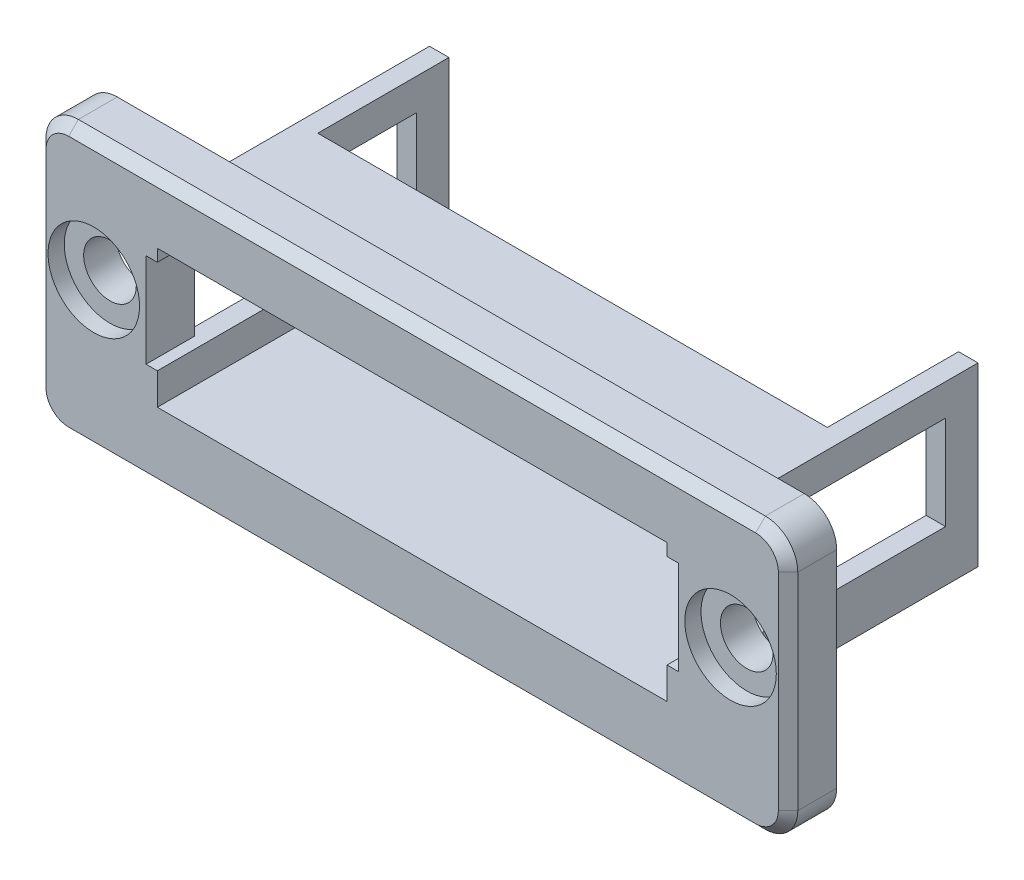
from build123d import *

# Parameters (mm, degrees)
FLANGE_DEPTH             = 3
FRONT_BEVEL_SIZE         = 0.6
OPENING_HOLES_DEPTH      = 26.160177364
OPENING_HOLES_DEPTH_BACK = 26.160177364
SK_OPENING_R             = 1.625
SK_COUNTERBORE_R         = 2.825
COUNTERBORE_DEPTH        = 1
SK_LONG_WALLS_W          = 33.86
SK_LONG_WALLS_H          = 1.2
LONG_WALLS_DEPTH         = 6.9
SK_LEGS_W                = 1.2
SK_LEGS_H                = 1.95
SK_LEGS_H_2              = 3.15
LEGS_DEPTH               = 13
SK_LEG_TIES_W            = 1.2
SK_LEG_TIES_H            = 10.9
LEG_TIES_DEPTH           = 2


with BuildPart() as part:
    # SK Flange → Flange (new body)
    with BuildSketch(Plane.XY):
        with BuildLine():
            Line((-21.205, -9.25), (21.205, -9.25))
            ThreePointArc((21.205, -9.25), (22.619213562, -8.664213562), (23.205, -7.25))
            Line((23.205, -7.25), (23.205, 5.5))
            ThreePointArc((23.205, 5.5), (22.619213562, 6.914213562), (21.205, 7.5))
            Line((21.205, 7.5), (-21.205, 7.5))
            ThreePointArc((-21.205, 7.5), (-22.619213562, 6.914213562), (-23.205, 5.5))
            Line((-23.205, 5.5), (-23.205, -7.25))
            ThreePointArc((-23.205, -7.25), (-22.619213562, -8.664213562), (-21.205, -9.25))
        make_face()
    extrude(amount=FLANGE_DEPTH)

    # Front bevel
    front_bevel_edges = [part.edges().sort_by_distance(p)[0] for p in [
        (-23.205, -0.875, 3),
        (-22.619213562, 6.914213562, 3),
        (0, 7.5, 3),
        (22.619213562, 6.914213562, 3),
        (23.205, -0.875, 3),
        (22.619213562, -8.664213562, 3),
        (0, -9.25, 3),
        (-22.619213562, -8.664213562, 3),
    ]]
    chamfer(front_bevel_edges, length=FRONT_BEVEL_SIZE)

    # SK Opening → Opening + holes (cut, two sides: drawn at the far end of the back side and taken through both)
    with BuildSketch(Plane.XY.offset(-OPENING_HOLES_DEPTH_BACK)):
        with Locations((-19.655, 0)):
            Circle(SK_OPENING_R)
        with Locations((19.655, 0)):
            Circle(SK_OPENING_R)
        Polygon((-15.73, -4.85), (15.73, -4.85), (15.73, -2.9), (16.43, -2.9), (16.43, 2.9), (15.73, 2.9), (15.73, 3.65), (-15.73, 3.65), (-15.73, 2.9), (-16.43, 2.9), (-16.43, -2.9), (-15.73, -2.9), align=None)
    extrude(amount=OPENING_HOLES_DEPTH + OPENING_HOLES_DEPTH_BACK, mode=Mode.SUBTRACT)

    # SK Counterbore → Counterbore (cut)
    with BuildSketch(Plane.XY.offset(3)):
        with Locations((-19.655, 0)):
            Circle(SK_COUNTERBORE_R)
        with Locations((19.655, 0)):
            Circle(SK_COUNTERBORE_R)
    extrude(amount=-COUNTERBORE_DEPTH, mode=Mode.SUBTRACT)

    # SK Long walls → Long walls (add)
    with BuildSketch(Plane.XY):
        with Locations((0, 4.25)):
            Rectangle(SK_LONG_WALLS_W, SK_LONG_WALLS_H)
        with Locations((0, -5.45)):
            Rectangle(SK_LONG_WALLS_W, SK_LONG_WALLS_H)
    extrude(amount=-LONG_WALLS_DEPTH)

    # SK Legs → Legs (add)
    with BuildSketch(Plane.XY):
        with Locations((-16.33, 3.875)):
            Rectangle(SK_LEGS_W, SK_LEGS_H)
        with Locations((-16.33, -4.475)):
            Rectangle(SK_LEGS_W, SK_LEGS_H_2)
        with Locations((16.33, 3.875)):
            Rectangle(SK_LEGS_W, SK_LEGS_H)
        with Locations((16.33, -4.475)):
            Rectangle(SK_LEGS_W, SK_LEGS_H_2)
    extrude(amount=-LEGS_DEPTH)

    # SK Leg ties → Leg ties (add)
    with BuildSketch(Plane.XY.offset(-13)):
        with Locations((-16.33, -0.6)):
            Rectangle(SK_LEG_TIES_W, SK_LEG_TIES_H)
        with Locations((16.33, -0.6)):
            Rectangle(SK_LEG_TIES_W, SK_LEG_TIES_H)
    extrude(amount=-LEG_TIES_DEPTH)


solid = part.part
